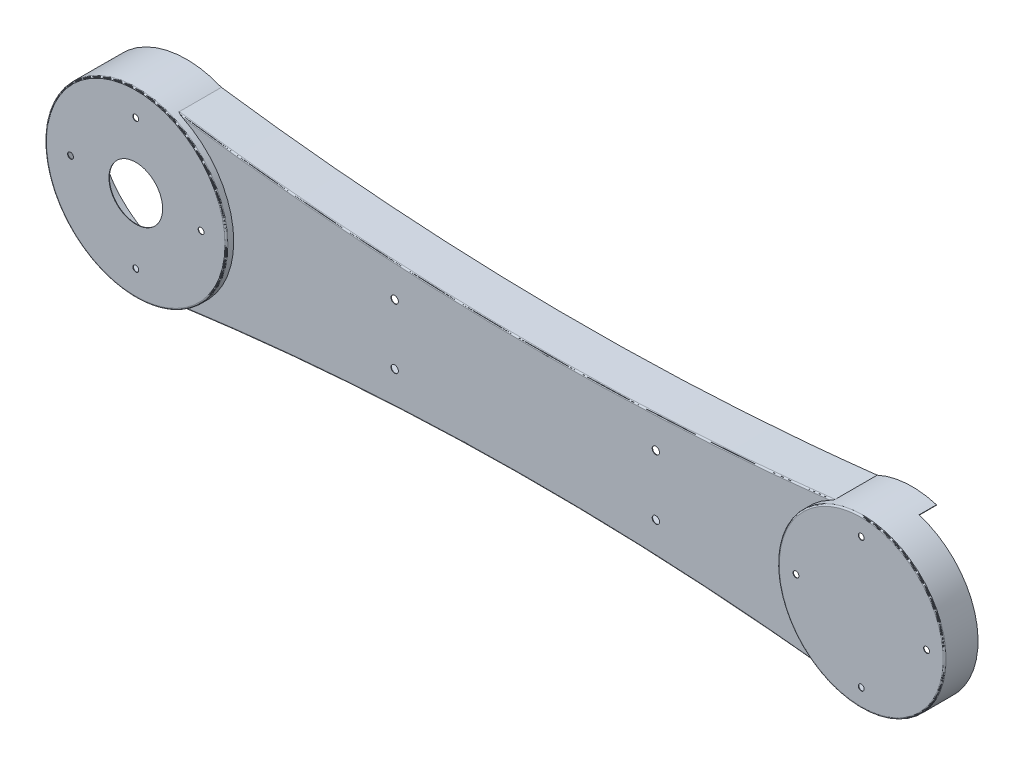
from build123d import *

# Parameters (mm, degrees)
SKETCH1_R                       = 62.5
BOSS_EXTRUDE1_DEPTH             = 35
SKETCH1_R_2                     = 57.5
BOSS_EXTRUDE1_2_DEPTH           = 35
BOSS_EXTRUDE2_DEPTH             = 30
SHELL1_DEPTH                    = 29.7
SHELL1_START                    = 29.7
SHELL1_2_OUTLINE_R              = 62.2
SHELL1_2_OUTLINE_R_2            = 57.2
SHELL1_2_DEPTH                  = 5
FILLET1_R                       = 1
F_4_0MM_DOWEL_HOLE1_D           = 4
F_4_0MM_DOWEL_HOLE1_DEPTH       = 4.798278762
F_4_0MM_DOWEL_HOLE1_CSINK_D     = 4.05
F_4_0MM_DOWEL_HOLE1_CSINK_ANGLE = 90
F_4_0MM_DOWEL_HOLE1_TIP         = 1.201721238
CUT_EXTRUDE1_DEPTH              = 12
SKETCH7_R                       = 18.5
CUT_EXTRUDE2_DEPTH              = 10
SKETCH10_R                      = 2.525
CUT_EXTRUDE3_DEPTH              = 52.6


# Read off the part's stored shape, not the designer's step: Shell1
with BuildPart() as part:
    # Sketch1 → Boss-Extrude1 (new body)
    with BuildSketch(Plane.XY):
        Circle(SKETCH1_R)
    extrude(amount=BOSS_EXTRUDE1_DEPTH)



with BuildPart() as body_2:
    # Sketch1 → Boss-Extrude1 2 (new body)
    with BuildSketch(Plane.XY):
        with Locations((500, 0)):
            Circle(SKETCH1_R_2)
    extrude(amount=BOSS_EXTRUDE1_2_DEPTH)


with BuildPart() as part_1:
    add(part.part)

    add(body_2.part)  # Boss-Extrude2 merges body 2
    # Sketch1<3> → Boss-Extrude2 (add)
    with BuildSketch(Plane.XY):
        with BuildLine():
            ThreePointArc((24, 57.708318291), (51.991585858, 34.686092314), (62.5, 0))
            ThreePointArc((62.5, 0), (51.991585858, -34.686092314), (24, -57.708318291))
            add(Edge.make_bspline(
                [(24, -57.708318291), (249.655903109, -26.361953469), (476, -52.251794228)],
                knots=[0, 0, 0, 1, 1, 1], degree=2))
            ThreePointArc((476, -52.251794228), (442.5, 0), (476, 52.251794228))
            add(Edge.make_bspline(
                [(24, 57.708318291), (249.655903109, 26.361953469), (476, 52.251794228)],
                knots=[0, 0, 0, 1, 1, 1], degree=2))
        make_face()
    extrude(amount=BOSS_EXTRUDE2_DEPTH)

    # Shell1 outline → Shell1 (cut)
    with BuildSketch(Plane.XY):
        with BuildLine():
            add(Edge.make_bspline(
                [(23.920417583, 57.416492601), (23.922485156, 57.41620539), (23.92455273, 57.415918179), (23.926620303, 57.415630968), (23.928687876, 57.415343757), (23.93075545, 57.415056545), (23.932823023, 57.414769334), (23.934890597, 57.414482123), (23.93695817, 57.414194912), (23.939025743, 57.4139077), (24.03100309, 57.401130922), (24.120970571, 57.388633851), (24.210808941, 57.376172233), (24.300857358, 57.363663527), (24.390654306, 57.351224794), (24.48067335, 57.338732085), (24.570550448, 57.326283056), (24.660490638, 57.31382161), (24.750413287, 57.301370163), (25.02018849, 57.264028957), (25.200038869, 57.239155014), (25.379889493, 57.214301267), (25.55974036, 57.189467714), (25.739591471, 57.164654357), (25.919442827, 57.139861195), (26.099294427, 57.115088228), (26.27914627, 57.090335456), (26.458998358, 57.065602879), (27.358260016, 56.94204097), (28.077673248, 56.843514565), (28.797090384, 56.745311282), (29.516511425, 56.647431121), (30.23593637, 56.549874082), (30.95536522, 56.452640165), (31.674797974, 56.35572937), (32.394234632, 56.259141697), (33.113675195, 56.162877147), (35.272008596, 55.875052861), (36.710913146, 55.684462492), (38.149833313, 55.495164612), (39.588769095, 55.307159222), (41.027720492, 55.12044632), (42.466687503, 54.935025908), (43.905670128, 54.750897986), (45.344668366, 54.568062554), (46.783682217, 54.386519611), (51.100770605, 53.845768256), (53.978891979, 53.490437314), (56.857075795, 53.140276336), (59.73532205, 52.795285322), (62.613630738, 52.455464275), (65.492001855, 52.120813196), (68.370435396, 51.791332087), (71.248931356, 51.46702095), (74.12748973, 51.147879786), (82.76335208, 50.205966218), (88.520843285, 49.59870374), (94.278584089, 49.012121174), (100.036574451, 48.446218529), (105.794814331, 47.900995817), (111.55330369, 47.376453048), (117.312042488, 46.872590232), (123.071030684, 46.389407379), (128.830268239, 45.9269045), (146.108728862, 44.601435817), (157.62869989, 43.800509997), (169.149667866, 43.082304184), (180.671632455, 42.446818413), (192.194593326, 41.894052721), (203.718550144, 41.424007145), (215.243502577, 41.03668172), (226.769450291, 40.732076484), (238.296392954, 40.510191472), (261.35226751, 40.231861971), (272.881199392, 40.175417482), (284.411125544, 40.201693226), (295.942045633, 40.310689175), (307.473959323, 40.5024053), (319.006866283, 40.776841573), (330.540766177, 41.133997966), (342.075658672, 41.57387445), (353.611543433, 42.096470997), (370.916858474, 43.004445869), (376.685544806, 43.327784161), (382.454479081, 43.671802443), (388.22366126, 44.036500708), (393.993091303, 44.421878944), (399.762769169, 44.827937143), (405.532694819, 45.254675296), (411.302868211, 45.702093393), (417.073289307, 46.170191424), (425.729292445, 46.903358359), (428.61468874, 47.152917318), (431.500146946, 47.407646256), (434.385667059, 47.667545172), (437.271249072, 47.932614064), (440.156892982, 48.202852931), (443.042598784, 48.478261771), (445.928366473, 48.758840583), (448.814196043, 49.044589365), (453.143033214, 49.480967491), (454.585994407, 49.627719359), (456.028971069, 49.775763718), (457.471963198, 49.925100569), (458.914970796, 50.075729912), (460.357993859, 50.227651746), (461.80103239, 50.380866071), (463.244086386, 50.535372886), (464.687155847, 50.691172193), (466.851783236, 50.926809888), (467.573329565, 51.005678909), (468.29487976, 51.084871053), (469.016433821, 51.164386319), (469.737991748, 51.244224708), (470.45955354, 51.324386219), (471.181119199, 51.404870852), (471.902688723, 51.485678609), (472.624262113, 51.566809487), (473.526233682, 51.668626988), (473.706628237, 51.689010684), (473.887023034, 51.709414574), (474.067418073, 51.72983866), (474.247813353, 51.750282941), (474.428208875, 51.770747417), (474.608604639, 51.791232088), (474.789000643, 51.811736954), (474.96939689, 51.832262015), (475.239991622, 51.8630799), (475.330187554, 51.873356964), (475.420401262, 51.883643599), (475.510551597, 51.893919346), (475.60084489, 51.904235332), (475.690914846, 51.914502719), (475.781237891, 51.924833989), (475.871349809, 51.935123256), (475.961591658, 51.945444847), (476.054773048, 51.956103183), (476.057770462, 51.956446035), (476.060767877, 51.956788888), (476.063765291, 51.95713174), (476.066762705, 51.957474592), (476.06976012, 51.957817444), (476.072757534, 51.958160296), (476.075754949, 51.958503149), (476.078752363, 51.958846001), (476.081749777, 51.959188853)],
                knots=[-8.4875e-05, -8.4875e-05, -8.4875e-05, -8.4875e-05, -8.4875e-05, -8.4875e-05, -8.4875e-05, -8.4875e-05, -8.4875e-05, -8.4875e-05, -8.4875e-05, -3.9063e-05, -3.9063e-05, -3.9063e-05, -3.9063e-05, -3.9063e-05, -3.9063e-05, -3.9063e-05, -3.9063e-05, -3.9063e-05, 0.001953125, 0.001953125, 0.001953125, 0.001953125, 0.001953125, 0.001953125, 0.001953125, 0.001953125, 0.001953125, 0.0059375, 0.0059375, 0.0059375, 0.0059375, 0.0059375, 0.0059375, 0.0059375, 0.0059375, 0.0059375, 0.021875, 0.021875, 0.021875, 0.021875, 0.021875, 0.021875, 0.021875, 0.021875, 0.021875, 0.05375, 0.05375, 0.05375, 0.05375, 0.05375, 0.05375, 0.05375, 0.05375, 0.05375, 0.1175, 0.1175, 0.1175, 0.1175, 0.1175, 0.1175, 0.1175, 0.1175, 0.1175, 0.245, 0.245, 0.245, 0.245, 0.245, 0.245, 0.245, 0.245, 0.245, 0.5, 0.5, 0.5, 0.5, 0.5, 0.5, 0.5, 0.5, 0.5, 0.755, 0.755, 0.755, 0.755, 0.755, 0.755, 0.755, 0.755, 0.755, 0.8825, 0.8825, 0.8825, 0.8825, 0.8825, 0.8825, 0.8825, 0.8825, 0.8825, 0.94625, 0.94625, 0.94625, 0.94625, 0.94625, 0.94625, 0.94625, 0.94625, 0.94625, 0.978125, 0.978125, 0.978125, 0.978125, 0.978125, 0.978125, 0.978125, 0.978125, 0.978125, 0.9940625, 0.9940625, 0.9940625, 0.9940625, 0.9940625, 0.9940625, 0.9940625, 0.9940625, 0.9940625, 0.998046875, 0.998046875, 0.998046875, 0.998046875, 0.998046875, 0.998046875, 0.998046875, 0.998046875, 0.998046875, 1.000039062, 1.000039062, 1.000039062, 1.000039062, 1.000039062, 1.000039062, 1.000039062, 1.000039062, 1.000039062, 1.000105276, 1.000105276, 1.000105276, 1.000105276, 1.000105276, 1.000105276, 1.000105276, 1.000105276, 1.000105276, 1.000105276, 1.000105276], degree=10))
            ThreePointArc((23.920417583, 57.416492601), (-62.2, 0), (23.920417583, -57.416492601))
            add(Edge.make_bspline(
                [(23.920417583, -57.416492601), (23.922485156, -57.41620539), (23.92455273, -57.415918179), (23.926620303, -57.415630968), (23.928687876, -57.415343757), (23.93075545, -57.415056545), (23.932823023, -57.414769334), (23.934890597, -57.414482123), (23.93695817, -57.414194912), (23.939025743, -57.4139077), (24.03100309, -57.401130922), (24.120970571, -57.388633851), (24.210808941, -57.376172233), (24.300857358, -57.363663527), (24.390654306, -57.351224794), (24.48067335, -57.338732085), (24.570550448, -57.326283056), (24.660490638, -57.31382161), (24.750413287, -57.301370163), (25.02018849, -57.264028957), (25.200038869, -57.239155014), (25.379889493, -57.214301267), (25.55974036, -57.189467714), (25.739591471, -57.164654357), (25.919442827, -57.139861195), (26.099294427, -57.115088228), (26.27914627, -57.090335456), (26.458998358, -57.065602879), (27.358260016, -56.94204097), (28.077673248, -56.843514565), (28.797090384, -56.745311282), (29.516511425, -56.647431121), (30.23593637, -56.549874082), (30.95536522, -56.452640165), (31.674797974, -56.35572937), (32.394234632, -56.259141697), (33.113675195, -56.162877147), (35.272008596, -55.875052861), (36.710913146, -55.684462492), (38.149833313, -55.495164612), (39.588769095, -55.307159222), (41.027720492, -55.12044632), (42.466687503, -54.935025908), (43.905670128, -54.750897986), (45.344668366, -54.568062554), (46.783682217, -54.386519611), (51.100770605, -53.845768256), (53.978891979, -53.490437314), (56.857075795, -53.140276336), (59.73532205, -52.795285322), (62.613630738, -52.455464275), (65.492001855, -52.120813196), (68.370435396, -51.791332087), (71.248931356, -51.46702095), (74.12748973, -51.147879786), (82.76335208, -50.205966218), (88.520843285, -49.59870374), (94.278584089, -49.012121174), (100.036574451, -48.446218529), (105.794814331, -47.900995817), (111.55330369, -47.376453048), (117.312042488, -46.872590232), (123.071030684, -46.389407379), (128.830268239, -45.9269045), (146.108728862, -44.601435817), (157.62869989, -43.800509997), (169.149667866, -43.082304184), (180.671632455, -42.446818413), (192.194593326, -41.894052721), (203.718550144, -41.424007145), (215.243502577, -41.03668172), (226.769450291, -40.732076484), (238.296392954, -40.510191472), (261.35226751, -40.231861971), (272.881199392, -40.175417482), (284.411125544, -40.201693226), (295.942045633, -40.310689175), (307.473959323, -40.5024053), (319.006866283, -40.776841573), (330.540766177, -41.133997966), (342.075658672, -41.57387445), (353.611543433, -42.096470997), (370.916858474, -43.004445869), (376.685544806, -43.327784161), (382.454479081, -43.671802443), (388.22366126, -44.036500708), (393.993091303, -44.421878944), (399.762769169, -44.827937143), (405.532694819, -45.254675296), (411.302868211, -45.702093393), (417.073289307, -46.170191424), (425.729292445, -46.903358359), (428.61468874, -47.152917318), (431.500146946, -47.407646256), (434.385667059, -47.667545172), (437.271249072, -47.932614064), (440.156892982, -48.202852931), (443.042598784, -48.478261771), (445.928366473, -48.758840583), (448.814196043, -49.044589365), (453.143033214, -49.480967491), (454.585994407, -49.627719359), (456.028971069, -49.775763718), (457.471963198, -49.925100569), (458.914970796, -50.075729912), (460.357993859, -50.227651746), (461.80103239, -50.380866071), (463.244086386, -50.535372886), (464.687155847, -50.691172193), (466.851783236, -50.926809888), (467.573329565, -51.005678909), (468.29487976, -51.084871053), (469.016433821, -51.164386319), (469.737991748, -51.244224708), (470.45955354, -51.324386219), (471.181119199, -51.404870852), (471.902688723, -51.485678609), (472.624262113, -51.566809487), (473.526233682, -51.668626988), (473.706628237, -51.689010684), (473.887023034, -51.709414574), (474.067418073, -51.72983866), (474.247813353, -51.750282941), (474.428208875, -51.770747417), (474.608604639, -51.791232088), (474.789000643, -51.811736954), (474.96939689, -51.832262015), (475.239991622, -51.8630799), (475.330187554, -51.873356964), (475.420401262, -51.883643599), (475.510551597, -51.893919346), (475.60084489, -51.904235332), (475.690914846, -51.914502719), (475.781237891, -51.924833989), (475.871349809, -51.935123256), (475.961591658, -51.945444847), (476.054773048, -51.956103183), (476.057770462, -51.956446035), (476.060767877, -51.956788888), (476.063765291, -51.95713174), (476.066762705, -51.957474592), (476.06976012, -51.957817444), (476.072757534, -51.958160296), (476.075754949, -51.958503149), (476.078752363, -51.958846001), (476.081749777, -51.959188853)],
                knots=[-8.4875e-05, -8.4875e-05, -8.4875e-05, -8.4875e-05, -8.4875e-05, -8.4875e-05, -8.4875e-05, -8.4875e-05, -8.4875e-05, -8.4875e-05, -8.4875e-05, -3.9063e-05, -3.9063e-05, -3.9063e-05, -3.9063e-05, -3.9063e-05, -3.9063e-05, -3.9063e-05, -3.9063e-05, -3.9063e-05, 0.001953125, 0.001953125, 0.001953125, 0.001953125, 0.001953125, 0.001953125, 0.001953125, 0.001953125, 0.001953125, 0.0059375, 0.0059375, 0.0059375, 0.0059375, 0.0059375, 0.0059375, 0.0059375, 0.0059375, 0.0059375, 0.021875, 0.021875, 0.021875, 0.021875, 0.021875, 0.021875, 0.021875, 0.021875, 0.021875, 0.05375, 0.05375, 0.05375, 0.05375, 0.05375, 0.05375, 0.05375, 0.05375, 0.05375, 0.1175, 0.1175, 0.1175, 0.1175, 0.1175, 0.1175, 0.1175, 0.1175, 0.1175, 0.245, 0.245, 0.245, 0.245, 0.245, 0.245, 0.245, 0.245, 0.245, 0.5, 0.5, 0.5, 0.5, 0.5, 0.5, 0.5, 0.5, 0.5, 0.755, 0.755, 0.755, 0.755, 0.755, 0.755, 0.755, 0.755, 0.755, 0.8825, 0.8825, 0.8825, 0.8825, 0.8825, 0.8825, 0.8825, 0.8825, 0.8825, 0.94625, 0.94625, 0.94625, 0.94625, 0.94625, 0.94625, 0.94625, 0.94625, 0.94625, 0.978125, 0.978125, 0.978125, 0.978125, 0.978125, 0.978125, 0.978125, 0.978125, 0.978125, 0.9940625, 0.9940625, 0.9940625, 0.9940625, 0.9940625, 0.9940625, 0.9940625, 0.9940625, 0.9940625, 0.998046875, 0.998046875, 0.998046875, 0.998046875, 0.998046875, 0.998046875, 0.998046875, 0.998046875, 0.998046875, 1.000039062, 1.000039062, 1.000039062, 1.000039062, 1.000039062, 1.000039062, 1.000039062, 1.000039062, 1.000039062, 1.000105276, 1.000105276, 1.000105276, 1.000105276, 1.000105276, 1.000105276, 1.000105276, 1.000105276, 1.000105276, 1.000105276, 1.000105276], degree=10))
            ThreePointArc((476.081749777, -51.959188853), (557.2, 0), (476.081749777, 51.959188853))
        make_face()
    extrude(amount=SHELL1_DEPTH, mode=Mode.SUBTRACT)

    # Shell1 2 outline → Shell1 2 (cut)
    with BuildSketch(Plane.XY.offset(SHELL1_START)):
        Circle(SHELL1_2_OUTLINE_R)
        with Locations((500, 0)):
            Circle(SHELL1_2_OUTLINE_R_2)
    extrude(amount=SHELL1_2_DEPTH, mode=Mode.SUBTRACT)

    # Fillet1
    fillet1_edges = [part_1.edges().sort_by_distance(p)[0] for p in [
        (442.5, 0, 35),
        (-62.5, 0, 35),
        (249.827264606, 40.671013157, 30),
        (249.827264606, -40.671013157, 30),
    ]]
    fillet(fillet1_edges, radius=FILLET1_R)

    # Ø4.0mm Dowel Hole1
    with Locations(Plane.XY.offset(35)):
        with Locations((455, 0), (0, 45), (45, 0), (0, -45), (-45, 0), (500, 45), (545, 0), (500, -45)):
            CounterSinkHole(F_4_0MM_DOWEL_HOLE1_D / 2, F_4_0MM_DOWEL_HOLE1_CSINK_D / 2, depth=F_4_0MM_DOWEL_HOLE1_DEPTH, counter_sink_angle=F_4_0MM_DOWEL_HOLE1_CSINK_ANGLE)
            with Locations((0, 0, -(F_4_0MM_DOWEL_HOLE1_DEPTH + F_4_0MM_DOWEL_HOLE1_TIP / 2))):  # 118° drill point
                Cone(0, F_4_0MM_DOWEL_HOLE1_D / 2, F_4_0MM_DOWEL_HOLE1_TIP, mode=Mode.SUBTRACT)

    # Sketch6 → Cut-Extrude1 (cut)
    with BuildSketch(Plane(origin=(0, 0, 0), x_dir=(-1, 0, 0), z_dir=(0, 0, -1))):
        with BuildLine():
            Line((-516.85093089, 54.975413851), (-500, -57.5))
            ThreePointArc((-500, -57.5), (-556.865351034, -8.519498329), (-516.85093089, 54.975413851))
        make_face()
    extrude(amount=-CUT_EXTRUDE1_DEPTH, mode=Mode.SUBTRACT)

    # Sketch7 → Cut-Extrude2 (cut)
    with BuildSketch(Plane.XY.offset(35)):
        Circle(SKETCH7_R)
    extrude(amount=-CUT_EXTRUDE2_DEPTH, mode=Mode.SUBTRACT)

    # Sketch10 → Cut-Extrude3 (cut)
    with BuildSketch(Plane.XY.offset(30)):
        with Locations((353.431505476, 20.714261618)):
            Circle(SKETCH10_R)
        with Locations((173.431505476, 20.71426162)):
            Circle(SKETCH10_R)
        with Locations((353.431505475, -20.714261625)):
            Circle(SKETCH10_R)
        with Locations((173.431505475, -20.714261623)):
            Circle(SKETCH10_R)
    extrude(amount=-CUT_EXTRUDE3_DEPTH, mode=Mode.SUBTRACT)


solid = part_1.part
